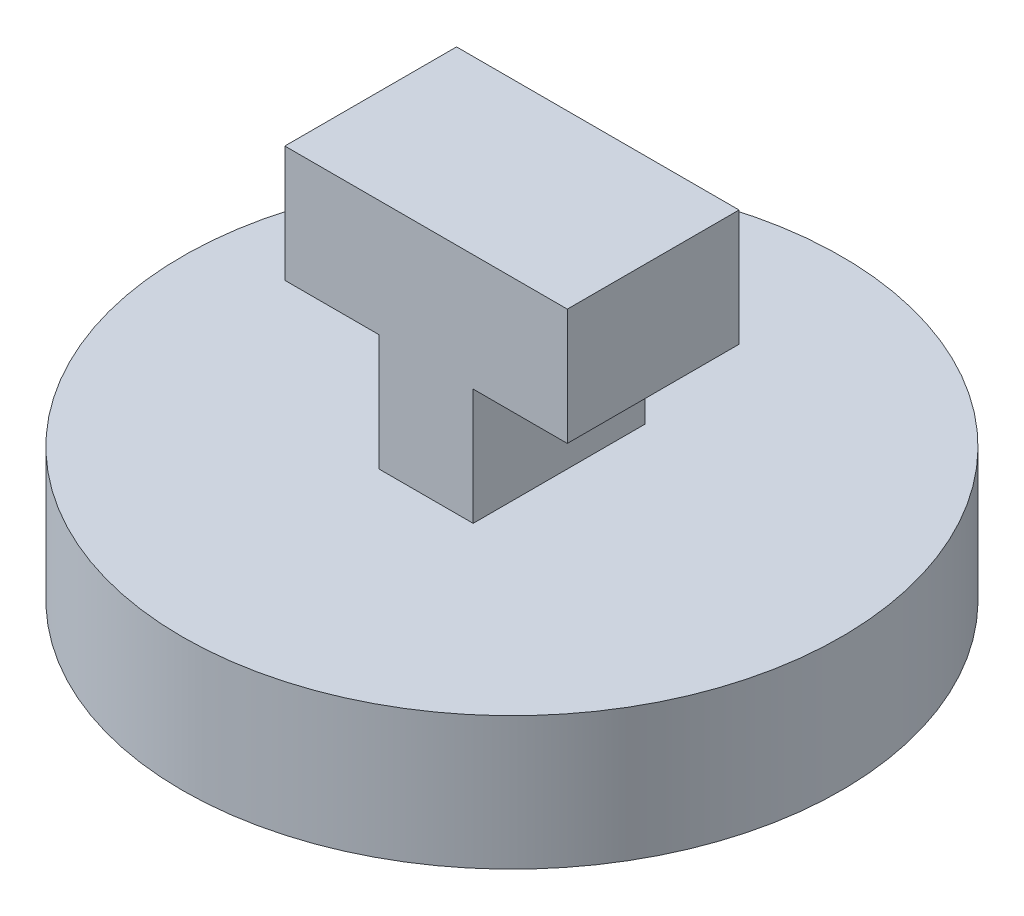
from build123d import *

# Parameters (mm, degrees)
SKETCH2_R                = 5.95
BOSS_EXTRUDE2_DEPTH      = 2.4
BOSS_EXTRUDE3_DEPTH      = 1.55
BOSS_EXTRUDE3_DEPTH_BACK = 1.55


with BuildPart() as part:
    # Sketch2 → Boss-Extrude2 (new body)
    with BuildSketch(Plane(origin=(0, 0, 0), x_dir=(1, 0, 0), z_dir=(0, 1, 0))):
        Circle(SKETCH2_R)
    extrude(amount=BOSS_EXTRUDE2_DEPTH)

    # Sketch4 → Boss-Extrude3 (add, two sides: drawn at the far end of the back side and taken through both)
    with BuildSketch(Plane.XY.offset(-BOSS_EXTRUDE3_DEPTH_BACK)):
        Polygon((-0.85, 2.4), (-0.85, 4.5), (-2.55, 4.5), (-2.55, 6.6), (2.55, 6.6), (2.55, 4.5), (0.85, 4.5), (0.85, 2.4), align=None)
    extrude(amount=BOSS_EXTRUDE3_DEPTH + BOSS_EXTRUDE3_DEPTH_BACK)


solid = part.part
